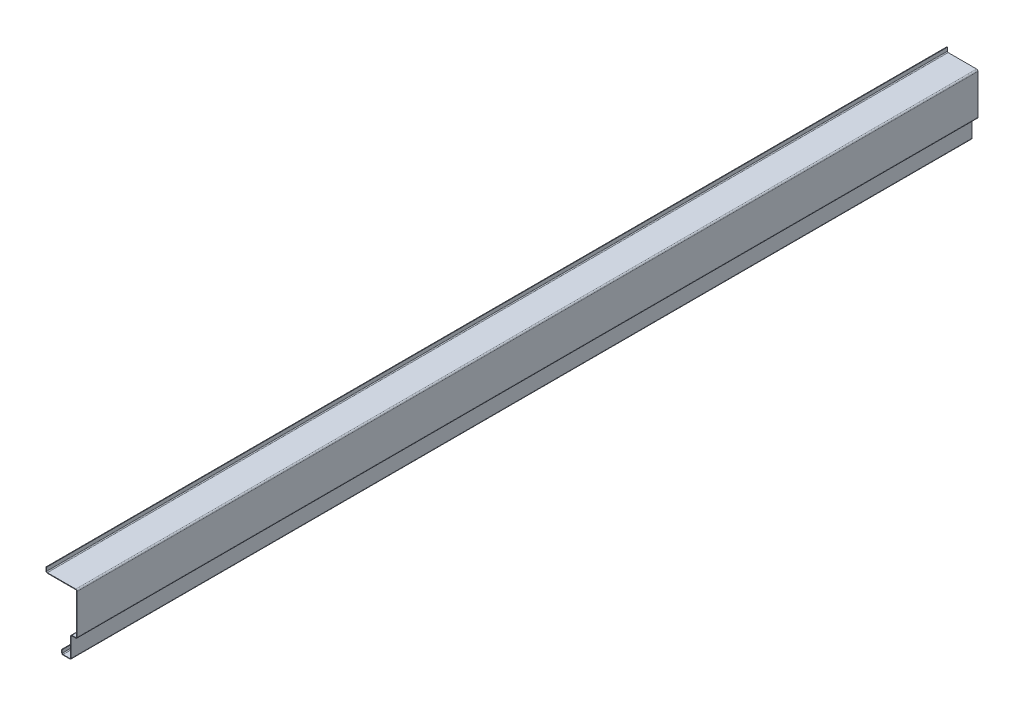
from build123d import *

# Parameters (mm, degrees)
BASE_FLANGE1_DEPTH = 2080


# Sheet-metal steps are written as plain solids
with BuildPart() as part:
    # Sketch1 → Base-Flange1 (new body)
    with BuildSketch(Plane.XY):
        with BuildLine():
            Line((0, 10), (0, 2))
            ThreePointArc((0, 2), (0.585786438, 0.585786438), (2, 0))
            Line((2, 0), (67.5, 0))
            ThreePointArc((67.5, 0), (69.798097039, -0.951902961), (70.75, -3.25))
            Line((70.75, -3.25), (70.75, -94.75))
            ThreePointArc((70.75, -94.75), (69.798097039, -97.048097039), (67.5, -98))
            Line((67.5, -98), (59, -98))
            ThreePointArc((59, -98), (57.585786438, -98.585786438), (57, -100))
            Line((57, -100), (57, -143.5))
            ThreePointArc((57, -143.5), (56.048097039, -145.798097039), (53.75, -146.75))
            Line((53.75, -146.75), (38.25, -146.75))
            ThreePointArc((38.25, -146.75), (35.951902961, -145.798097039), (35, -143.5))
            Line((35, -143.5), (35, -136.75))
            Line((35, -136.75), (36.25, -136.75))
            Line((36.25, -136.75), (36.25, -143.5))
            ThreePointArc((36.25, -143.5), (36.835786438, -144.914213562), (38.25, -145.5))
            Line((38.25, -145.5), (53.75, -145.5))
            ThreePointArc((53.75, -145.5), (55.164213562, -144.914213562), (55.75, -143.5))
            Line((55.75, -143.5), (55.75, -100))
            ThreePointArc((55.75, -100), (56.701902961, -97.701902961), (59, -96.75))
            Line((59, -96.75), (67.5, -96.75))
            ThreePointArc((67.5, -96.75), (68.914213562, -96.164213562), (69.5, -94.75))
            Line((69.5, -94.75), (69.5, -3.25))
            ThreePointArc((69.5, -3.25), (68.914213562, -1.835786438), (67.5, -1.25))
            Line((67.5, -1.25), (2, -1.25))
            ThreePointArc((2, -1.25), (-0.298097039, -0.298097039), (-1.25, 2))
            Line((-1.25, 2), (-1.25, 10))
            Line((-1.25, 10), (0, 10))
        make_face()
    extrude(amount=BASE_FLANGE1_DEPTH)


solid = part.part
